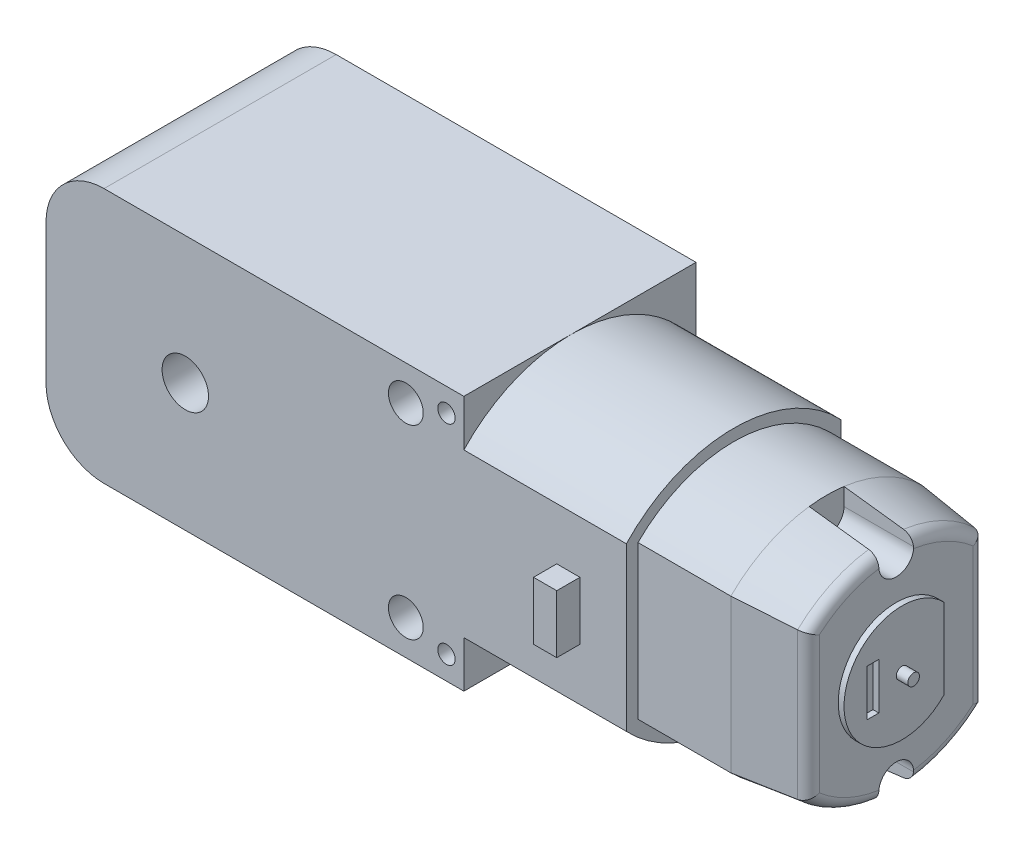
from build123d import *

# Parameters (mm, degrees)
CROQUIS1_W               = 50
CROQUIS1_H               = 20
SALIENTE_EXTRUIR1_DEPTH  = 11
REDONDEO1_R              = 5
CROQUIS2_OUTSIDE_W       = 33.634
CROQUIS2_OUTSIDE_H       = 35.634
CORTAR_EXTRUIR1_DEPTH    = 14
CROQUIS3_R               = 1.5
CORTAR_EXTRUIR2_DEPTH    = 34.85262176
CROQUIS4_W               = 2
CROQUIS4_H               = 5
SALIENTE_EXTRUIR2_DEPTH  = 2
CROQUIS5_W               = 2
CROQUIS5_H               = 5
SALIENTE_EXTRUIR5_DEPTH  = 2
CROQUIS6_R               = 0.75
CROQUIS6_R_2             = 0.25
CROQUIS6_R_3             = 0.9
CORTAR_EXTRUIR3_DEPTH    = 5
CORTAR_EXTRUIR4_START    = -5
CROQUIS7_R               = 0.75
CORTAR_EXTRUIR4_DEPTH    = 5
SALIENTE_EXTRUIR6_DEPTH  = 8
CROQUIS9_R               = 2
CORTAR_EXTRUIR5_DEPTH    = 41.376354466
SALIENTE_EXTRUIR7_DEPTH  = 6
SALIENTE_EXTRUIR7_DRAFT  = 7
REDONDEO2_R              = 1
CROQUIS12_W              = 1
CROQUIS12_H              = 4
SALIENTE_EXTRUIR8_DEPTH  = 0.5
CROQUIS13_R              = 0.5
SALIENTE_EXTRUIR9_DEPTH  = 1
CORTAR_EXTRUIR6_START    = -6
CORTAR_EXTRUIR6_DEPTH    = 6
CROQUIS15_W              = 2
CROQUIS15_H              = 5
SALIENTE_EXTRUIR10_DEPTH = 5.5
CROQUIS16_R              = 1.5
CORTAR_EXTRUIR7_DEPTH    = 44.514365444


with BuildPart() as part:
    # Croquis1 → Saliente-Extruir1 (new, symmetric)
    with BuildSketch(Plane(origin=(0, 0, 0), x_dir=(1, 0, 0), z_dir=(0, 1, 0))):
        Rectangle(CROQUIS1_W, CROQUIS1_H)
    extrude(amount=SALIENTE_EXTRUIR1_DEPTH, both=True)

    # Redondeo1
    redondeo1_edges = [part.edges().sort_by_distance(p)[0] for p in [
        (-25, 11, 0),
        (-25, -11, 0),
    ]]
    fillet(redondeo1_edges, radius=REDONDEO1_R)

    # Croquis2 outside → Cortar-Extruir1 (cut)
    with BuildSketch(Plane(origin=(25, 0, 0), x_dir=(0, 0, -1), z_dir=(1, 0, 0))):
        Rectangle(CROQUIS2_OUTSIDE_W, CROQUIS2_OUTSIDE_H)
        with BuildLine():
            Line((-10, 7), (-10, -7))
            ThreePointArc((-10, -7), (-0.75, -11), (8.5, -7))
            Line((8.5, -7), (8.5, 7))
            ThreePointArc((8.5, 7), (-0.75, 11), (-10, 7))
        make_face(mode=Mode.SUBTRACT)
    extrude(amount=-CORTAR_EXTRUIR1_DEPTH, mode=Mode.SUBTRACT)

    # Croquis3 → Cortar-Extruir2 (cut, through all)
    with BuildSketch(Plane(origin=(0, 0, -10), x_dir=(-1, 0, 0), z_dir=(0, 0, -1))):
        with Locations((-6, 8)):
            Circle(CROQUIS3_R)
        with Locations(Location((-6, -8, 0), (0, 0, 180))):
            Circle(CROQUIS3_R)
    extrude(amount=-CORTAR_EXTRUIR2_DEPTH, mode=Mode.SUBTRACT)

    # Croquis4 → Saliente-Extruir2 (add)
    with BuildSketch(Plane.XY.offset(10)):
        with Locations((20, 0)):
            Rectangle(CROQUIS4_W, CROQUIS4_H)
    extrude(amount=SALIENTE_EXTRUIR2_DEPTH)

    # Croquis5 → Saliente-Extruir5 (add)
    with BuildSketch(Plane(origin=(0, 0, -8.5), x_dir=(-1, 0, 0), z_dir=(0, 0, -1))):
        with Locations((-20, 0)):
            Rectangle(CROQUIS5_W, CROQUIS5_H)
    extrude(amount=SALIENTE_EXTRUIR5_DEPTH)

    # Croquis6 → Cortar-Extruir3 (cut)
    with BuildSketch(Plane(origin=(0, 0, -10), x_dir=(-1, 0, 0), z_dir=(0, 0, -1))):
        with Locations((-9.5, 9)):
            Circle(CROQUIS6_R)
        with Locations((-9.5, -9)):
            Circle(CROQUIS6_R)
        with Locations((4.5, -10)):
            Circle(CROQUIS6_R_2)
        with Locations((4.5, 10)):
            Circle(CROQUIS6_R_2)
        with Locations((22, 9)):
            Circle(CROQUIS6_R_3)
        with Locations((22, -9)):
            Circle(CROQUIS6_R_3)
    extrude(amount=-CORTAR_EXTRUIR3_DEPTH, mode=Mode.SUBTRACT)

    # Croquis7 → Cortar-Extruir4 (cut)
    with BuildSketch(Plane.XY.offset(10).offset(CORTAR_EXTRUIR4_START)):
        with Locations(Location((9.5, -9, 0), (0, 0, 180))):
            Circle(CROQUIS7_R)
        with Locations(Location((9.5, 9, 0), (0, 0, 180))):
            Circle(CROQUIS7_R)
    extrude(amount=CORTAR_EXTRUIR4_DEPTH, mode=Mode.SUBTRACT)

    # Croquis8 → Saliente-Extruir6 (add)
    with BuildSketch(Plane(origin=(25, 0, 0), x_dir=(0, 0, -1), z_dir=(1, 0, 0))):
        with BuildLine():
            Line((-9, 6.594309595), (-9, -6.594309595))
            ThreePointArc((-9, -6.594309595), (-0.75, -10), (7.5, -6.594309595))
            Line((7.5, -6.594309595), (7.5, 6.594309595))
            ThreePointArc((7.5, 6.594309595), (-0.75, 10), (-9, 6.594309595))
        make_face()
    extrude(amount=SALIENTE_EXTRUIR6_DEPTH)

    # Croquis9 → Cortar-Extruir5 (cut, through all)
    with BuildSketch(Plane.XY.offset(10)):
        with Locations((-13, 0)):
            Circle(CROQUIS9_R)
    extrude(amount=-CORTAR_EXTRUIR5_DEPTH, mode=Mode.SUBTRACT)


with BuildPart() as saliente_extruir7_tool:
    # Croquis11 → Saliente-Extruir7 (with draft: the straight prism first)
    with BuildSketch(Plane(origin=(33, 0, 0), x_dir=(0, 0, -1), z_dir=(1, 0, 0))):
        with BuildLine():
            Line((-9, 6.594309595), (-9, -6.594309595))
            ThreePointArc((-9, -6.594309595), (-0.75, -10), (7.5, -6.594309595))
            Line((7.5, -6.594309595), (7.5, 6.594309595))
            ThreePointArc((7.5, 6.594309595), (-0.75, 10), (-9, 6.594309595))
        make_face()
    extrude(amount=SALIENTE_EXTRUIR7_DEPTH)
    # Saliente-Extruir7: the draft: its side faces are tilted about the plane it starts from
    saliente_extruir7_sides = [saliente_extruir7_tool.faces().sort_by_distance(p)[0] for p in [
        (36, 0, 9),
        (36, -10, 0.75),
        (36, 0, -7.5),
        (36, 10, 0.75),
    ]]
    draft(saliente_extruir7_sides, Plane(origin=(33, 0, 0), x_dir=(0, 0, -1), z_dir=(1, 0, 0)), SALIENTE_EXTRUIR7_DRAFT)


with BuildPart() as part_1:
    add(part.part)

    # Saliente-Extruir7: add saliente_extruir7_tool
    add(saliente_extruir7_tool.part)

    # Redondeo2
    redondeo2_edges = [part_1.edges().sort_by_distance(p)[0] for p in [
        (39, 0, -6.763292635),
        (39, -9.263292635, 0.75),
        (39, 0, 8.263292635),
        (39, 9.263292635, 0.75),
    ]]
    fillet(redondeo2_edges, radius=REDONDEO2_R - 0.0001)  # a hair under: the kernel refuses the full size

    # Croquis12 → Saliente-Extruir8 (add)
    with BuildSketch(Plane(origin=(39, 0, 0), x_dir=(0, 0, -1), z_dir=(1, 0, 0))):
        with BuildLine():
            Line((2.87856737, 3.439985297), (2.87856737, -3.439985297))
            ThreePointArc((2.87856737, -3.439985297), (-5.75, 0), (2.87856737, 3.439985297))
        make_face()
        with Locations((-3.25, 0)):
            Rectangle(CROQUIS12_W, CROQUIS12_H, mode=Mode.SUBTRACT)
    extrude(amount=SALIENTE_EXTRUIR8_DEPTH)

    # Croquis13 → Saliente-Extruir9 (add)
    with BuildSketch(Plane(origin=(39.5, 0, 0), x_dir=(0, 0, -1), z_dir=(1, 0, 0))):
        with Locations((-0.75, 0)):
            Circle(CROQUIS13_R)
    extrude(amount=SALIENTE_EXTRUIR9_DEPTH)

    # Croquis14 → Cortar-Extruir6 (cut)
    with BuildSketch(Plane(origin=(39, 0, 0), x_dir=(0, 0, -1), z_dir=(1, 0, 0)).offset(CORTAR_EXTRUIR6_START)):
        with BuildLine():
            Line((-2.25, 9.903408743), (-2.25, 8.403408743))
            ThreePointArc((-2.25, 8.403408743), (-0.75, 6.903408743), (0.75, 8.403408743))
            Line((0.75, 8.403408743), (0.75, 9.903408743))
            ThreePointArc((0.75, 9.903408743), (-0.75, 10), (-2.25, 9.903408743))
        make_face()
        with BuildLine():
            Line((-2.25, -9.903408743), (-2.25, -8.403408743))
            ThreePointArc((-2.25, -8.403408743), (-0.75, -6.903408743), (0.75, -8.403408743))
            Line((0.75, -8.403408743), (0.75, -9.903408743))
            ThreePointArc((0.75, -9.903408743), (-0.75, -10), (-2.25, -9.903408743))
        make_face()
    extrude(amount=CORTAR_EXTRUIR6_DEPTH, mode=Mode.SUBTRACT)

    # Croquis15 → Saliente-Extruir10 (add)
    with BuildSketch(Plane.ZY.offset(25)):
        Rectangle(CROQUIS15_W, CROQUIS15_H)
    extrude(amount=SALIENTE_EXTRUIR10_DEPTH)

    # Croquis16 → Cortar-Extruir7 (cut, through all)
    with BuildSketch(Plane.XY.offset(1)):
        with Locations((-27.75, 0)):
            Circle(CROQUIS16_R)
    extrude(amount=-CORTAR_EXTRUIR7_DEPTH, mode=Mode.SUBTRACT)


solid = part_1.part
